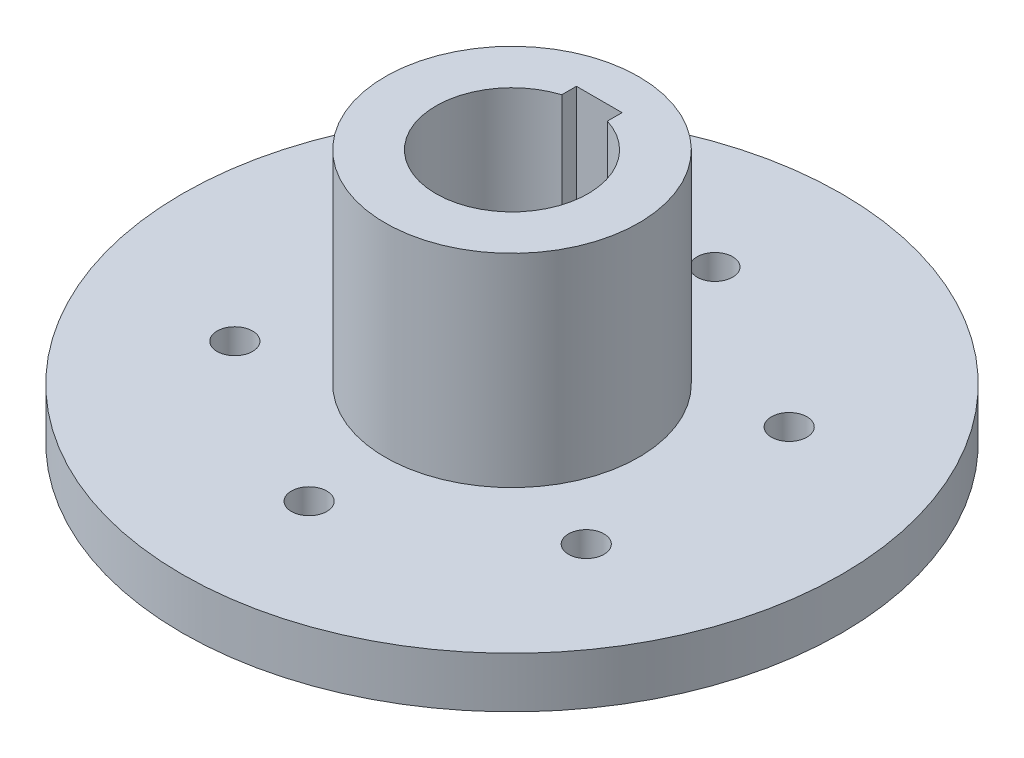
from build123d import *

# Parameters (mm, degrees)
SKETCH2_R          = 7
SKETCH2_W          = 18
SKETCH2_H          = 11
CUT_EXTRUDE1_DEPTH = 230.128784748


with BuildPart() as part:
    # Sketch1 → Revolve1 (revolve)
    with BuildSketch(Plane.XY):
        Polygon((0, 0), (0, 100), (20, 100), (20, 20), (100, 20), (100, 0), align=None)
    revolve(axis=Axis((-30, -0.140675199, 0), (0, 1, 0)))

    # Sketch2 → Cut-Extrude1 (cut, through all)
    with BuildSketch(Plane(origin=(0, 100, 0), x_dir=(1, 0, 0), z_dir=(0, 1, 0))):
        with Locations((-30, 80)):
            Circle(SKETCH2_R)
        with Locations((39.282032303, 40)):
            Circle(SKETCH2_R)
        with Locations((39.282032303, -40)):
            Circle(SKETCH2_R)
        with Locations((-30, -80)):
            Circle(SKETCH2_R)
        with Locations((-99.282032303, -40)):
            Circle(SKETCH2_R)
        with Locations((-99.282032303, 40)):
            Circle(SKETCH2_R)
        with Locations((-30, 28.9)):
            Rectangle(SKETCH2_W, SKETCH2_H)
    extrude(amount=-CUT_EXTRUDE1_DEPTH, mode=Mode.SUBTRACT)


solid = part.part
